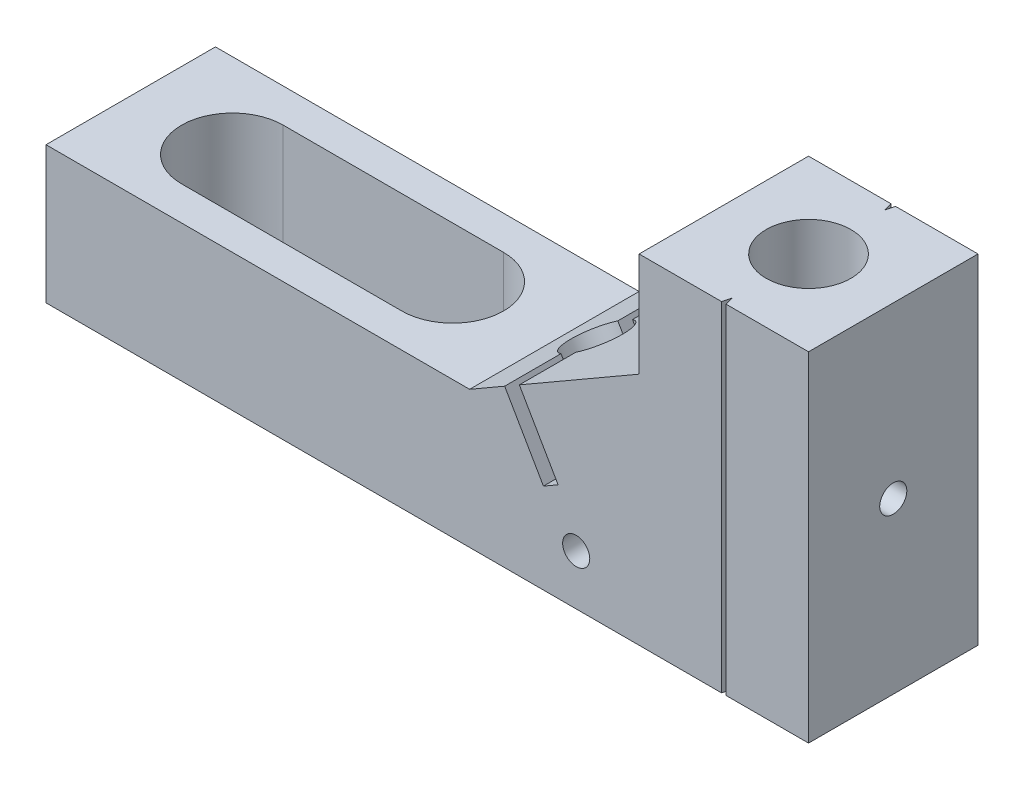
from build123d import *

# Parameters (mm, degrees)
SKETCH1_W                 = 20
SKETCH1_H                 = 10
BOSS_EXTRUDE1_DEPTH       = 20
SKETCH2_R                 = 2.5
CUT_EXTRUDE1_DEPTH        = 26.836409614
CUT_EXTRUDE2_DEPTH        = 27.191969955
SKETCH5_R                 = 1.75
CUT_EXTRUDE5_DEPTH        = 21.021203074
M2X0_4_TAPPED_HOLE1_D     = 1.6
M2X0_4_TAPPED_HOLE1_DEPTH = 6
M2X0_4_TAPPED_HOLE1_TIP   = 0.480688495
M2X0_4_TAPPED_HOLE2_D     = 1.6
M2X0_4_TAPPED_HOLE2_DEPTH = 6
M2X0_4_TAPPED_HOLE2_TIP   = 0.480688495
SKETCH14_W                = 10
SKETCH14_H                = 8.082903769
BOSS_EXTRUDE3_DEPTH       = 25
CUT_EXTRUDE7_REACH        = 43.43


with BuildPart() as part:
    # Sketch1 → Boss-Extrude1 (new body)
    with BuildSketch(Plane(origin=(0, 0, 0), x_dir=(1, 0, 0), z_dir=(0, 1, 0))):
        with Locations((-3.638888889, 4.027777778)):
            Rectangle(SKETCH1_W, SKETCH1_H)
    extrude(amount=BOSS_EXTRUDE1_DEPTH)

    # Sketch2 → Cut-Extrude1 (cut, through all)
    with BuildSketch(Plane(origin=(0, 20, 0), x_dir=(1, 0, 0), z_dir=(0, 1, 0))):
        with Locations((1.361111111, 4.027777778)):
            Circle(SKETCH2_R)
        Polygon((1.495085707, -0.972222222), (1.361111111, -0.472222222), (1.227136515, -0.972222222), align=None)
        Polygon((1.361111111, 8.527777778), (1.227136515, 9.027777778), (1.495085707, 9.027777778), align=None)
    extrude(amount=-CUT_EXTRUDE1_DEPTH, mode=Mode.SUBTRACT)

    # Sketch3 → Cut-Extrude2 (cut, through all)
    with BuildSketch(Plane.XY.offset(0.972222222)):
        Polygon((-13.638888889, 20), (-3.638888889, 20), (-3.638888889, 13.856406461), (-10.705876187, 9.776279442), (-8.417376187, 5.812481169), (-9.283401591, 5.312481169), (-11.571901591, 9.276279442), (-13.638888889, 8.082903769), align=None)
    extrude(amount=-CUT_EXTRUDE2_DEPTH, mode=Mode.SUBTRACT)

    # Sketch5 → Cut-Extrude5 (cut, through all)
    with BuildSketch(Plane(origin=(-6.909722222, 11.967989955, 0), x_dir=(0.8660254037844415, 0.49999999999999534, 0), z_dir=(-0.49999999999999534, 0.8660254037844415, 0))):
        with Locations((-4.883421027, 4.027777778)):
            Circle(SKETCH5_R)
    extrude(amount=-CUT_EXTRUDE5_DEPTH, mode=Mode.SUBTRACT)

    # M2x0.4 Tapped Hole1
    with Locations(Plane(origin=(6.361111111, 0, 0), x_dir=(0, 0, -1), z_dir=(1, 0, 0))):
        with Locations((4.027777778, 10)):
            Hole(M2X0_4_TAPPED_HOLE1_D / 2, depth=M2X0_4_TAPPED_HOLE1_DEPTH)
            with Locations((0, 0, -(M2X0_4_TAPPED_HOLE1_DEPTH + M2X0_4_TAPPED_HOLE1_TIP / 2))):  # 118° drill point
                Cone(0, M2X0_4_TAPPED_HOLE1_D / 2, M2X0_4_TAPPED_HOLE1_TIP, mode=Mode.SUBTRACT)

    # M2x0.4 Tapped Hole2
    with Locations(Plane.XY.offset(0.972222222)):
        with Locations((-7.350388889, 2.964404957)):
            Hole(M2X0_4_TAPPED_HOLE2_D / 2, depth=M2X0_4_TAPPED_HOLE2_DEPTH)
            with Locations((0, 0, -(M2X0_4_TAPPED_HOLE2_DEPTH + M2X0_4_TAPPED_HOLE2_TIP / 2))):  # 118° drill point
                Cone(0, M2X0_4_TAPPED_HOLE2_D / 2, M2X0_4_TAPPED_HOLE2_TIP, mode=Mode.SUBTRACT)

    # Sketch14 → Boss-Extrude3 (add)
    with BuildSketch(Plane.ZY.offset(13.638888889)):
        with Locations((-4.027777778, 4.041451884)):
            Rectangle(SKETCH14_W, SKETCH14_H)
    extrude(amount=BOSS_EXTRUDE3_DEPTH)

    # Sketch15 → Cut-Extrude7 (cut, up to next)
    with BuildSketch(Plane(origin=(0, 8.082903769, 0), x_dir=(1, 0, 0), z_dir=(0, 1, 0)), mode=Mode.PRIVATE) as cut_extrude7_sk1:
        with BuildLine():
            Line((-19.638888889, 1.027777778), (-32.638888889, 1.027777778))
            ThreePointArc((-32.638888889, 1.027777778), (-35.638888889, 4.027777778), (-32.638888889, 7.027777778))
            Line((-32.638888889, 7.027777778), (-19.638888889, 7.027777778))
            ThreePointArc((-19.638888889, 7.027777778), (-16.638888889, 4.027777778), (-19.638888889, 1.027777778))
        make_face()
    cut_extrude7_tool1 = extrude(cut_extrude7_sk1.sketch, amount=-CUT_EXTRUDE7_REACH, mode=Mode.PRIVATE) & part.part
    add(cut_extrude7_tool1.solids().sort_by_distance((-26.138889, 8.082904, -4.027778))[0], mode=Mode.SUBTRACT)


solid = part.part
